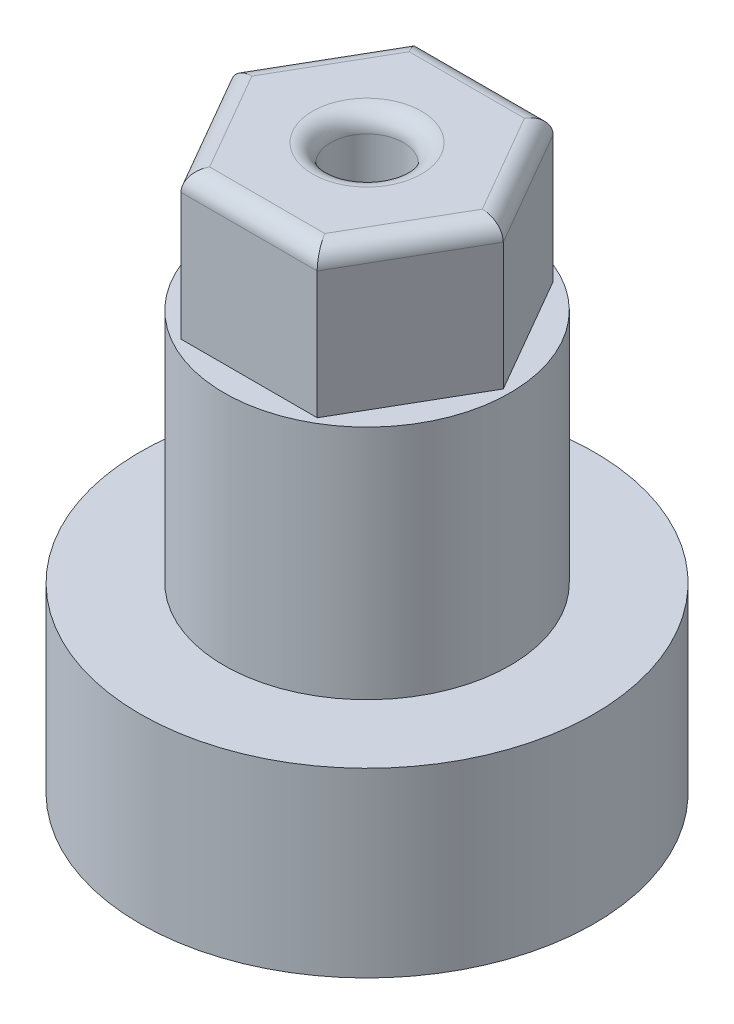
from build123d import *

# Parameters (mm, degrees)
CROQUIS1_R              = 12.5
CROQUIS1_R_2            = 0.75
SALIENTE_EXTRUIR1_DEPTH = 10
CROQUIS2_R              = 7.875
SALIENTE_EXTRUIR2_DEPTH = 13
SALIENTE_EXTRUIR3_DEPTH = 8
CROQUIS4_R              = 2
CORTAR_EXTRUIR1_DEPTH   = 36.68613176
REDONDEO1_R             = 1


with BuildPart() as part:
    # Croquis1 → Saliente-Extruir1 (new body)
    with BuildSketch(Plane(origin=(0, 0, 0), x_dir=(1, 0, 0), z_dir=(0, 1, 0))):
        Circle(CROQUIS1_R)
        with Locations((7, 0)):
            Circle(CROQUIS1_R_2, mode=Mode.SUBTRACT)
        with Locations((0, -7)):
            Circle(CROQUIS1_R_2, mode=Mode.SUBTRACT)
        with Locations((-7, 0)):
            Circle(CROQUIS1_R_2, mode=Mode.SUBTRACT)
        with Locations((0, 7)):
            Circle(CROQUIS1_R_2, mode=Mode.SUBTRACT)
    extrude(amount=SALIENTE_EXTRUIR1_DEPTH)

    # Croquis2 → Saliente-Extruir2 (add)
    with BuildSketch(Plane(origin=(0, 10, 0), x_dir=(1, 0, 0), z_dir=(0, 1, 0))):
        Circle(CROQUIS2_R)
    extrude(amount=SALIENTE_EXTRUIR2_DEPTH)

    # Croquis3 → Saliente-Extruir3 (add)
    with BuildSketch(Plane(origin=(0, 23, 0), x_dir=(1, 0, 0), z_dir=(0, 1, 0))):
        Polygon((7.5, 0), (3.75, 6.495190528), (-3.75, 6.495190528), (-7.5, 0), (-3.75, -6.495190528), (3.75, -6.495190528), align=None)
    extrude(amount=SALIENTE_EXTRUIR3_DEPTH)

    # Croquis4 → Cortar-Extruir1 (cut, through all)
    with BuildSketch(Plane(origin=(0, 31, 0), x_dir=(1, 0, 0), z_dir=(0, 1, 0))):
        Circle(CROQUIS4_R)
    extrude(amount=-CORTAR_EXTRUIR1_DEPTH, mode=Mode.SUBTRACT)

    # Redondeo1
    redondeo1_edges = [part.edges().sort_by_distance(p)[0] for p in [
        (0, 31, 6.495190528),
        (-5.625, 31, 3.247595264),
        (-5.625, 31, -3.247595264),
        (0, 31, -6.495190528),
        (5.625, 31, -3.247595264),
        (5.625, 31, 3.247595264),
        (-2, 31, 0),
    ]]
    fillet(redondeo1_edges, radius=REDONDEO1_R)


solid = part.part
